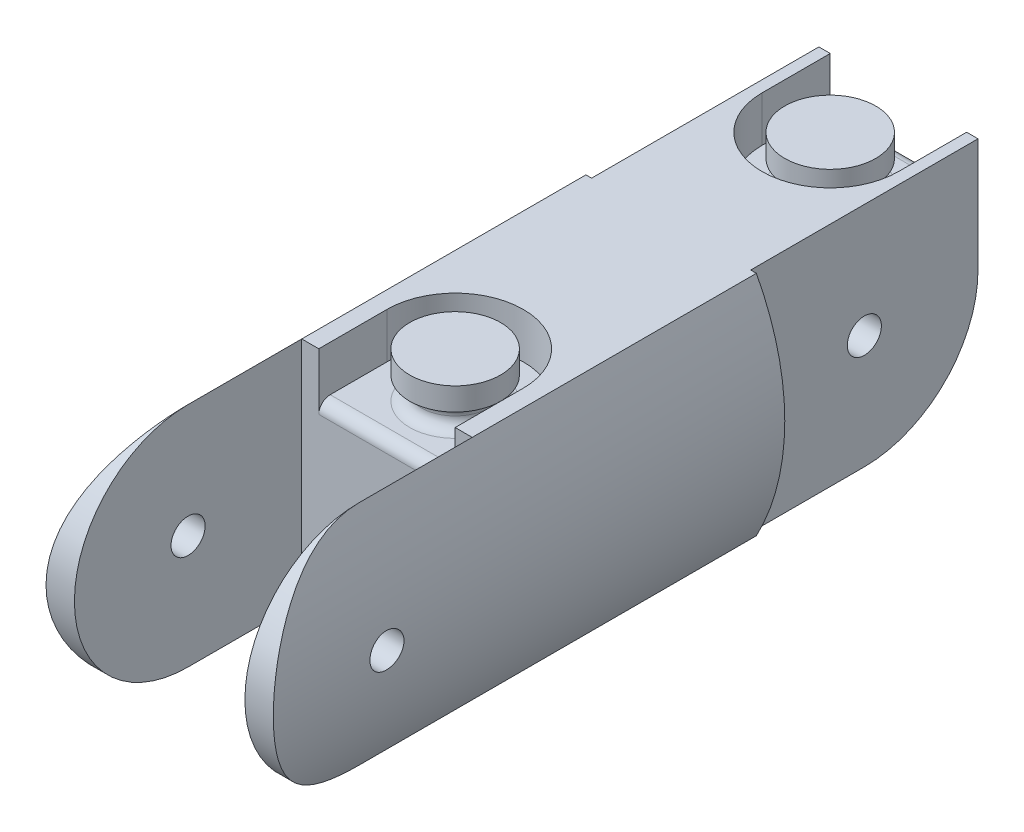
from build123d import *

# Parameters (mm, degrees)
SALIENTE_EXTRUIR2_DEPTH    = 45
CROQUIS4_R                 = 1.5
CORTAR_EXTRUIR1_DEPTH      = 50
SALIENTE_EXTRUIR3_DEPTH    = 20
CROQUIS8_R                 = 1.5
CORTAR_EXTRUIR4_DEPTH      = 14
REDONDEO1_R                = 10
CROQUIS6_W                 = 15
CROQUIS6_H                 = 20
CORTAR_EXTRUIR2_DEPTH      = 20
CORTAR_EXTRUIR3_DEPTH      = 48.16990566
CORTAR_EXTRUIR3_DEPTH_BACK = 48.16990566
CROQUIS7_R                 = 1.5
CUT_EXTRUDE1_DEPTH         = 4
SKETCH2_R                  = 3
BOSS_EXTRUDE1_DEPTH        = 2
SKETCH3_R                  = 4
BOSS_EXTRUDE2_DEPTH        = 2
FILLET2_R                  = 1
FILLET3_R                  = 1
FILLET4_R                  = 1


with BuildPart() as part:
    # Croquis2 → Saliente-Extruir2 (new body)
    with BuildSketch(Plane.XY):
        with BuildLine():
            Line((-7.5, -10), (7.5, -10))
            ThreePointArc((7.5, -10), (10, 0), (7.5, 10))
            Line((7.5, 10), (-7.5, 10))
            ThreePointArc((-7.5, 10), (-10, 0), (-7.5, -10))
        make_face()
    extrude(amount=SALIENTE_EXTRUIR2_DEPTH)

    # Croquis4 → Cortar-Extruir1 (cut)
    with BuildSketch(Plane(origin=(0, 0, 0), x_dir=(-1, 0, 0), z_dir=(0, 0, -1))):
        with Locations((0, -7)):
            Circle(CROQUIS4_R)
    extrude(amount=-CORTAR_EXTRUIR1_DEPTH, mode=Mode.SUBTRACT)

    # Croquis3 → Saliente-Extruir3 (add)
    with BuildSketch(Plane(origin=(0, 0, 0), x_dir=(-1, 0, 0), z_dir=(0, 0, -1))):
        Polygon((7, 10), (7, -10), (3, -10), (3, -3), (-3, -3), (-3, -10), (-7, -10), (-7, 10), align=None)
    extrude(amount=SALIENTE_EXTRUIR3_DEPTH)

    # Croquis8 → Cortar-Extruir4 (cut)
    with BuildSketch(Plane.ZY.offset(7)):
        with Locations((-10, 0)):
            Circle(CROQUIS8_R)
    extrude(amount=-CORTAR_EXTRUIR4_DEPTH, mode=Mode.SUBTRACT)

    # Redondeo1
    redondeo1_edges = [part.edges().sort_by_distance(p)[0] for p in [
        (5, -10, -20),
    ]]
    fillet(redondeo1_edges, radius=REDONDEO1_R)

    # Croquis6 → Cortar-Extruir2 (cut)
    with BuildSketch(Plane.XY.offset(45)):
        Rectangle(CROQUIS6_W, CROQUIS6_H)
    extrude(amount=-CORTAR_EXTRUIR2_DEPTH, mode=Mode.SUBTRACT)

    # Croquis7 → Cortar-Extruir3 (cut, two sides: drawn at the far end of the back side and taken through both)
    with BuildSketch(Plane(origin=(0, 0, 0), x_dir=(0, 0, -1), z_dir=(1, 0, 0)).offset(-CORTAR_EXTRUIR3_DEPTH_BACK)):
        with Locations((-35, 0)):
            Circle(CROQUIS7_R)
        with BuildLine():
            Line((-35, -10), (-50, -10))
            Line((-50, -10), (-50, 10))
            Line((-50, 10), (-35, 10))
            ThreePointArc((-35, 10), (-45, 0), (-35, -10))
        make_face()
    extrude(amount=CORTAR_EXTRUIR3_DEPTH + CORTAR_EXTRUIR3_DEPTH_BACK, mode=Mode.SUBTRACT)

    # Sketch1 → Cut-Extrude1 (cut)
    with BuildSketch(Plane(origin=(0, 10, 0), x_dir=(1, 0, 0), z_dir=(0, 1, 0))):
        with BuildLine():
            Line((-6, 14), (-6, 20))
            Line((-6, 20), (6, 20))
            Line((6, 20), (6, 14))
            ThreePointArc((6, 14), (0, 8), (-6, 14))
        make_face()
        with BuildLine():
            Line((-6, -19), (-6, -25))
            Line((-6, -25), (6, -25))
            Line((6, -25), (6, -19))
            ThreePointArc((6, -19), (0, -13), (-6, -19))
        make_face()
    extrude(amount=-CUT_EXTRUDE1_DEPTH, mode=Mode.SUBTRACT)

    # Sketch2 → Boss-Extrude1 (add)
    with BuildSketch(Plane(origin=(0, 6, 0), x_dir=(1, 0, 0), z_dir=(0, 1, 0))):
        with Locations(Location((0, -19, 0), (0, 0, 270))):
            Circle(SKETCH2_R)
        with Locations(Location((0, 14, 0), (0, 0, 270))):
            Circle(SKETCH2_R)
    extrude(amount=BOSS_EXTRUDE1_DEPTH)

    # Sketch3 → Boss-Extrude2 (add)
    with BuildSketch(Plane(origin=(0, 8, 0), x_dir=(1, 0, 0), z_dir=(0, 1, 0))):
        with Locations(Location((0, -19, 0), (0, 0, 270))):
            Circle(SKETCH3_R)
        with Locations(Location((0, 14, 0), (0, 0, 270))):
            Circle(SKETCH3_R)
    extrude(amount=BOSS_EXTRUDE2_DEPTH)

    # Fillet2
    fillet2_edges = [part.edges().sort_by_distance(p)[0] for p in [
        (0, 6, 16),
        (0, 8, 16),
        (0, 6, -17),
        (0, 8, -17),
    ]]
    fillet(fillet2_edges, radius=FILLET2_R - 0.0001)  # a hair under: the kernel refuses the full size

    # Fillet3
    fillet3_edges = [part.edges().sort_by_distance(p)[0] for p in [
        (0, 6, -20),
        (0, 6, 25),
    ]]
    fillet(fillet3_edges, radius=FILLET3_R)

    # Fillet4
    fillet4_edges = [part.edges().sort_by_distance(p)[0] for p in [
        (1.5, -7, 0),
        (1.5, -7, 25),
    ]]
    fillet(fillet4_edges, radius=FILLET4_R)


solid = part.part
